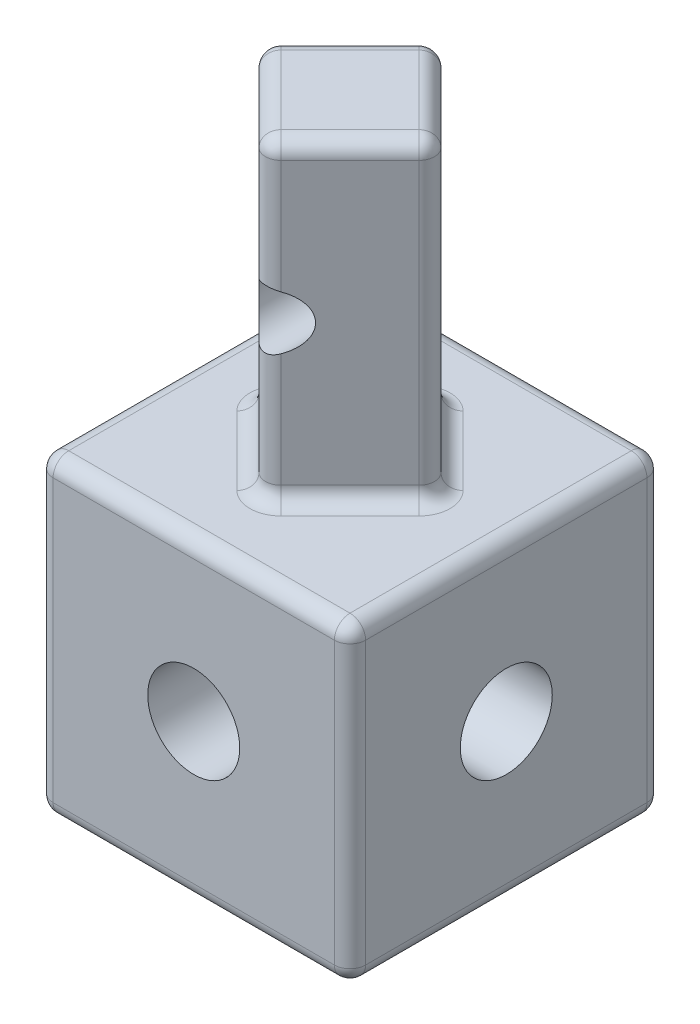
from build123d import *
from build123d.topology import SkipClean

# Parameters (mm, degrees)
SKETCH1_W              = 17
SKETCH1_H              = 17
BOSS_EXTRUDE1_DEPTH    = 17
BOSS_EXTRUDE2_DEPTH    = 17
CUT_EXTRUDE1_START     = 3.550252598
CUT_EXTRUDE1_OUTLINE_R = 1.6
CUT_EXTRUDE1_DEPTH     = 9.899494704
FILLET4_R              = 0.85
FILLET8_R              = 0.85
FILLET9_R              = 0.85
FILLET10_R             = 0.85


# Read off the part's stored shape, not the designer's step: Cut-Extrude1
with BuildPart() as part:
    # Sketch1 → Boss-Extrude1 (new body)
    with BuildSketch(Plane(origin=(0, 0, 0), x_dir=(1, 0, 0), z_dir=(0, 1, 0))):
        with Locations((8.5, -8.5)):
            Rectangle(SKETCH1_W, SKETCH1_H)
    extrude(amount=BOSS_EXTRUDE1_DEPTH)

    # Sketch2 → Boss-Extrude2 (add)
    with BuildSketch(Plane(origin=(0, 17, 0), x_dir=(1, 0, 0), z_dir=(0, 1, 0))):
        Polygon((3.550252365, -8.499999834), (8.500000166, -3.550252698), (13.449747635, -8.500000166), (8.499999834, -13.449747302), align=None)
    extrude(amount=BOSS_EXTRUDE2_DEPTH)

    # Cut-Extrude1 outline → Cut-Extrude1 (cut)
    with BuildSketch(Plane.XY.offset(CUT_EXTRUDE1_START)):
        with Locations((8.438376435, 25.498463761)):
            Circle(CUT_EXTRUDE1_OUTLINE_R)
    extrude(amount=CUT_EXTRUDE1_DEPTH, mode=Mode.SUBTRACT)

    # Sketch8 → CBORE for _00 Binding Head Machine Screw (revolve, cut)
    with BuildSketch(Plane(origin=(8.5, 8.5, 17), x_dir=(0, -1, 0), z_dir=(1, 0, 0))):
        Polygon((0, 0), (0, 10.915711583), (1.524, 10), (1.524, 5.400361895), (2.159, 4.0386), (2.5019, 4.0386), (2.5019, 0), align=None)
    revolve(axis=Axis((8.5, 8.5, 23.35), (0, 0, -1)), mode=Mode.SUBTRACT)

    # Sketch10 → CBORE for _00 Binding Head Machine S 2 (revolve, cut)
    with BuildSketch(Plane(origin=(17, 8.5, 8.5), x_dir=(0, 0, -1), z_dir=(0, 1, 0))):
        Polygon((0, 0), (0, 10), (1.524, 10), (1.524, 5.400361895), (2.159, 4.0386), (2.5019, 4.0386), (2.5019, 0), align=None)
    revolve(axis=Axis((23.35, 8.5, 8.5), (-1, 0, 0)), mode=Mode.SUBTRACT)

    # Sketch12 → CBORE for _00 Binding Head Machine S 3 (revolve, cut)
    with SkipClean():  # the faces are left unmerged after this step: merging them gives an invalid solid
        with BuildSketch(Plane(origin=(8.5, 8.5, 0), x_dir=(0, 1, 0), z_dir=(1, 0, 0))):
            Polygon((0, 0), (0, 10), (1.524, 10), (1.524, 5.400361895), (2.159, 4.0386), (2.5019, 4.0386), (2.5019, 0), align=None)
        revolve(axis=Axis((8.5, 8.5, -6.35), (0, 0, 1)), mode=Mode.SUBTRACT)

    # Sketch14 → CBORE for _00 Binding Head Machine S 4 (revolve, cut)
    with BuildSketch(Plane(origin=(0, 8.5, 8.5), x_dir=(0, 0, 1), z_dir=(0, 1, 0))):
        Polygon((0, 0), (0, 10), (1.524, 10), (1.524, 5.400361895), (2.159, 4.0386), (2.5019, 4.0386), (2.5019, 0), align=None)
    revolve(axis=Axis((-6.35, 8.5, 8.5), (1, 0, 0)), mode=Mode.SUBTRACT)

    # Sketch18 → CBORE for #0 Binding Head Machine Screw1 (revolve, cut)
    with BuildSketch(Plane(origin=(8.5, 0, 8.5), x_dir=(0, 0, -1), z_dir=(1, 0, 0))):
        Polygon((0, 0), (0, 18.5875), (1.5875, 17), (1.5875, 5.107235238), (1.6002, 5.08), (2.5019, 5.08), (2.5019, 0), align=None)
    revolve(axis=Axis((8.5, -6.35, 8.5), (0, 1, 0)), mode=Mode.SUBTRACT)

    # Fillet4
    fillet4_edges = [part.edges().sort_by_distance(p)[0] for p in [
        (6.025126099, 17, 10.974873568),
        (6.025126266, 17, 6.025126266),
        (10.974873734, 17, 10.974873734),
        (8.500000166, 30.548638303, 3.550252698),
        (8.500000166, 20.449825458, 3.550252698),
        (8.499999834, 20.449825451, 13.449747302),
        (8.499999834, 30.54863831, 13.449747302),
        (10.974873901, 17, 6.025126432),
        (13.449747635, 25.5, 8.500000166),
        (3.550252365, 25.5, 8.499999834),
        (6.025126099, 34, 10.974873568),
        (10.974873734, 34, 10.974873734),
        (10.974873901, 34, 6.025126432),
        (6.025126266, 34, 6.025126266),
    ]]
    fillet(fillet4_edges, radius=FILLET4_R)

    # Fillet8
    fillet8_edges = [part.edges().sort_by_distance(p)[0] for p in [
        (17, 0, 8.5),
        (17, 8.5, 0),
        (17, 8.5, 17),
    ]]
    fillet(fillet8_edges, radius=FILLET8_R)

    # Fillet9
    fillet9_edges = [part.edges().sort_by_distance(p)[0] for p in [
        (17, 17, 8.5),
        (8.075, 17, 0),
        (16.751040764, 17, 0.248959236),
        (16.751040764, 17, 16.751040764),
        (0, 17, 8.5),
        (8.075, 17, 17),
    ]]
    fillet(fillet9_edges, radius=FILLET9_R)

    # Fillet10
    # the kernel refuses this fillet: 0.85 mm, written as the material it takes off along each edge
    with BuildSketch(Plane(origin=(16.15, 0.85, 16.15), x_dir=(0, -1, 0), z_dir=(0, 0, 1))) as fillet10_piece_1_section:
        Polygon((0, 0), (FILLET10_R, 0), (FILLET10_R, FILLET10_R), (0, FILLET10_R), align=None)
    fillet10_piece_1 = extrude(amount=FILLET10_R, mode=Mode.PRIVATE)
    fillet10_piece_1 = fillet10_piece_1 - Plane(origin=(16.15, 0.85, 16.15), x_dir=(-0.7071067811865475, 0.7071067811865475, 0), z_dir=(0, 0, 1)) * Sphere(FILLET10_R, mode=Mode.PRIVATE)
    add(fillet10_piece_1, mode=Mode.SUBTRACT)
    with BuildSketch(Plane(origin=(16.15, 0.85, 0.85), x_dir=(0, -1, 0), z_dir=(0, 0, -1))) as fillet10_piece_2_section:
        Polygon((0, 0), (FILLET10_R, 0), (FILLET10_R, -FILLET10_R), (0, -FILLET10_R), align=None)
    fillet10_piece_2 = extrude(amount=FILLET10_R, mode=Mode.PRIVATE)
    fillet10_piece_2 = fillet10_piece_2 - Plane(origin=(16.15, 0.85, 0.85), x_dir=(-0.7071067811865475, 0.7071067811865475, 0), z_dir=(0, 0, -1)) * Sphere(FILLET10_R, mode=Mode.PRIVATE)
    add(fillet10_piece_2, mode=Mode.SUBTRACT)
    with BuildSketch(Plane(origin=(0.85, 16.15, 16.15), x_dir=(0, 0, 1), z_dir=(-1, 0, 0))) as fillet10_piece_3_section:
        Polygon((0, 0), (FILLET10_R, 0), (FILLET10_R, FILLET10_R), (0, FILLET10_R), align=None)
    fillet10_piece_3 = extrude(amount=FILLET10_R, mode=Mode.PRIVATE)
    fillet10_piece_3 = fillet10_piece_3 - Plane(origin=(0.85, 16.15, 16.15), x_dir=(0, -0.7071067811865475, -0.7071067811865475), z_dir=(-1, 0, 0)) * Sphere(FILLET10_R, mode=Mode.PRIVATE)
    add(fillet10_piece_3, mode=Mode.SUBTRACT)
    with BuildSketch(Plane(origin=(0.85, 16.15, 0.85), x_dir=(-1, 0, 0), z_dir=(0, 0, -1))) as fillet10_piece_4_section:
        Polygon((0, 0), (FILLET10_R, 0), (FILLET10_R, FILLET10_R), (0, FILLET10_R), align=None)
    fillet10_piece_4 = extrude(amount=FILLET10_R, mode=Mode.PRIVATE)
    fillet10_piece_4 = fillet10_piece_4 - Plane(origin=(0.85, 16.15, 0.85), x_dir=(0.7071067811865475, -0.7071067811865475, 0), z_dir=(0, 0, -1)) * Sphere(FILLET10_R, mode=Mode.PRIVATE)
    add(fillet10_piece_4, mode=Mode.SUBTRACT)
    with BuildSketch(Plane(origin=(0.85, 0.85, 0.85), x_dir=(0, 0, -1), z_dir=(0, -1, 0))) as fillet10_piece_5_section:
        Polygon((0, 0), (FILLET10_R, 0), (FILLET10_R, -FILLET10_R), (0, -FILLET10_R), align=None)
    fillet10_piece_5 = extrude(amount=FILLET10_R, mode=Mode.PRIVATE)
    fillet10_piece_5 = fillet10_piece_5 - Plane(origin=(0.85, 0.85, 0.85), x_dir=(0.7071067811865475, 0, 0.7071067811865475), z_dir=(0, -1, 0)) * Sphere(FILLET10_R, mode=Mode.PRIVATE)
    add(fillet10_piece_5, mode=Mode.SUBTRACT)
    with BuildSketch(Plane(origin=(0.85, 0.85, 16.15), x_dir=(0, -1, 0), z_dir=(0, 0, 1))) as fillet10_piece_6_section:
        Polygon((0, 0), (FILLET10_R, 0), (FILLET10_R, -FILLET10_R), (0, -FILLET10_R), align=None)
    fillet10_piece_6 = extrude(amount=FILLET10_R, mode=Mode.PRIVATE)
    fillet10_piece_6 = fillet10_piece_6 - Plane(origin=(0.85, 0.85, 16.15), x_dir=(0.7071067811865475, 0.7071067811865475, 0), z_dir=(0, 0, 1)) * Sphere(FILLET10_R, mode=Mode.PRIVATE)
    add(fillet10_piece_6, mode=Mode.SUBTRACT)
    with BuildSketch(Plane(origin=(0.85, 0, 0), x_dir=(0, 1, 0), z_dir=(1, 0, 0)), Plane(origin=(16.15, 0, 17), x_dir=(0, 1, 0), z_dir=(-1, 0, 0)), Plane(origin=(0, 0, 16.15), x_dir=(0, 1, 0), z_dir=(0, 0, -1))) as fillet10_piece_7:
        with BuildLine():
            CenterArc((FILLET10_R, FILLET10_R), FILLET10_R, 180, 90)
            Line((0, FILLET10_R), (0, 0))
            Line((0, 0), (FILLET10_R, 0))
        make_face()
    extrude(amount=15.3, mode=Mode.SUBTRACT)
    with BuildSketch(Plane(origin=(0, 0.85, 17), x_dir=(0, 0, -1), z_dir=(0, 1, 0)), Plane(origin=(0, 0.85, 0), x_dir=(1, 0, 0), z_dir=(0, 1, 0))) as fillet10_piece_8:
        with BuildLine():
            CenterArc((FILLET10_R, -FILLET10_R), FILLET10_R, 90, 90)
            Line((0, -FILLET10_R), (0, 0))
            Line((0, 0), (FILLET10_R, 0))
        make_face()
    extrude(amount=15.3, mode=Mode.SUBTRACT)


solid = part.part
